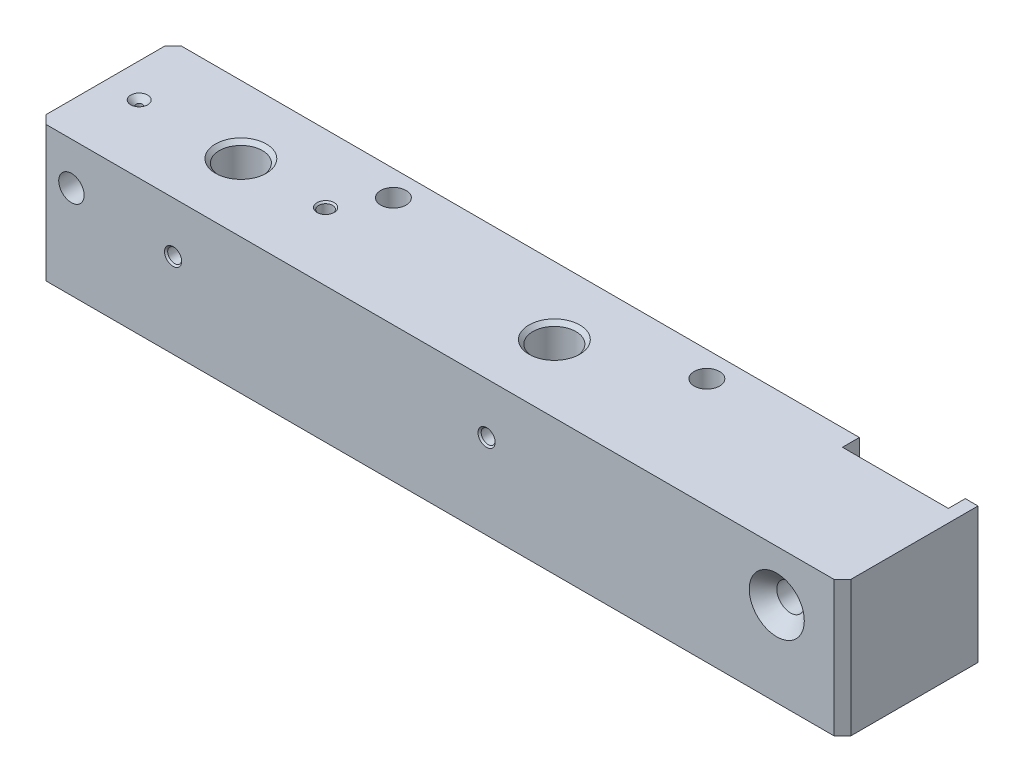
from build123d import *

# Parameters (mm, degrees)
SKETCH1_W                                            = 190
SKETCH1_H                                            = 32
BOSS_EXTRUDE1_DEPTH                                  = 16
CHAMFER1_SIZE                                        = 2
SKETCH2_W                                            = 25
SKETCH2_H                                            = 4
CUT_EXTRUDE1_DEPTH                                   = 102.513545894
M12_TAPPED_HOLE1_D                                   = 10.2
M12_TAPPED_HOLE1_DEPTH                               = 24
M12_TAPPED_HOLE1_CSINK_D                             = 12.005
M12_TAPPED_HOLE1_CSINK_ANGLE                         = 90
M12_TAPPED_HOLE1_TIP                                 = 3.064389157
M4_TAPPED_HOLE2_D                                    = 3.3
M4_TAPPED_HOLE2_DEPTH                                = 11.5
M4_TAPPED_HOLE2_CSINK_D                              = 4.05
M4_TAPPED_HOLE2_CSINK_ANGLE                          = 90
M4_TAPPED_HOLE2_TIP                                  = 0.991420021
CSK_FOR_M10_COUNTERSUNK_FLAT_HEAD_SCREW1_D           = 6.5
CSK_FOR_M10_COUNTERSUNK_FLAT_HEAD_SCREW1_CSINK_D     = 13
CSK_FOR_M10_COUNTERSUNK_FLAT_HEAD_SCREW1_CSINK_ANGLE = 90
SKETCH16_R                                           = 3
CUT_EXTRUDE2_DEPTH                                   = 102.513545894
CSK_FOR_M4_COUNTERSUNK_FLAT_HEAD_SCREW1_D            = 1.5
CSK_FOR_M4_COUNTERSUNK_FLAT_HEAD_SCREW1_DEPTH        = 10
CSK_FOR_M4_COUNTERSUNK_FLAT_HEAD_SCREW1_CSINK_D      = 4
CSK_FOR_M4_COUNTERSUNK_FLAT_HEAD_SCREW1_CSINK_ANGLE  = 90
CSK_FOR_M4_COUNTERSUNK_FLAT_HEAD_SCREW1_TIP          = 0.450645464
M4_TAPPED_HOLE3_D                                    = 3.3
M4_TAPPED_HOLE3_DEPTH                                = 16
M4_TAPPED_HOLE3_CSINK_D                              = 4.05
M4_TAPPED_HOLE3_CSINK_ANGLE                          = 90
M4_TAPPED_HOLE3_TIP                                  = 0.991420021
SKETCH24_R                                           = 3
CUT_EXTRUDE4_DEPTH                                   = 102.51354591


with BuildPart() as part:
    # Sketch1 → Boss-Extrude1 (new, symmetric)
    with BuildSketch(Plane.XY):
        Rectangle(SKETCH1_W, SKETCH1_H)
    extrude(amount=BOSS_EXTRUDE1_DEPTH, both=True)

    # Chamfer1
    chamfer1_edges = [part.edges().sort_by_distance(p)[0] for p in [
        (-95, 0, -16),
        (95, 0, 16),
        (-95, 0, 16),
    ]]
    chamfer(chamfer1_edges, length=CHAMFER1_SIZE)

    # Sketch2 → Cut-Extrude1 (cut, through all)
    with BuildSketch(Plane(origin=(0, 16, 0), x_dir=(1, 0, 0), z_dir=(0, 1, 0))):
        with Locations((79.5, 14)):
            Rectangle(SKETCH2_W, SKETCH2_H)
    extrude(amount=-CUT_EXTRUDE1_DEPTH, mode=Mode.SUBTRACT)

    # M12 Tapped Hole1
    with Locations(Plane(origin=(0, 16, 0), x_dir=(1, 0, 0), z_dir=(0, 1, 0))):
        with Locations((-63, 0), (11, 0)):
            CounterSinkHole(M12_TAPPED_HOLE1_D / 2, M12_TAPPED_HOLE1_CSINK_D / 2, depth=M12_TAPPED_HOLE1_DEPTH, counter_sink_angle=M12_TAPPED_HOLE1_CSINK_ANGLE)
            with Locations((0, 0, -(M12_TAPPED_HOLE1_DEPTH + M12_TAPPED_HOLE1_TIP / 2))):  # 118° drill point
                Cone(0, M12_TAPPED_HOLE1_D / 2, M12_TAPPED_HOLE1_TIP, mode=Mode.SUBTRACT)

    # M4 Tapped Hole2
    with Locations(Plane(origin=(-63, 4, 16), x_dir=(1, 0, 0), z_dir=(0, 0, 1))):
        with Locations((0, 0), (74, 0)):
            CounterSinkHole(M4_TAPPED_HOLE2_D / 2, M4_TAPPED_HOLE2_CSINK_D / 2, depth=M4_TAPPED_HOLE2_DEPTH, counter_sink_angle=M4_TAPPED_HOLE2_CSINK_ANGLE)
            with Locations((0, 0, -(M4_TAPPED_HOLE2_DEPTH + M4_TAPPED_HOLE2_TIP / 2))):  # 118° drill point
                Cone(0, M4_TAPPED_HOLE2_D / 2, M4_TAPPED_HOLE2_TIP, mode=Mode.SUBTRACT)

    # CSK for M10 Countersunk Flat Head Screw1 (through all)
    with Locations(Plane.XY.offset(16)):
        with Locations((79.5, 4)):
            CounterSinkHole(CSK_FOR_M10_COUNTERSUNK_FLAT_HEAD_SCREW1_D / 2, CSK_FOR_M10_COUNTERSUNK_FLAT_HEAD_SCREW1_CSINK_D / 2, counter_sink_angle=CSK_FOR_M10_COUNTERSUNK_FLAT_HEAD_SCREW1_CSINK_ANGLE)

    # Sketch16 → Cut-Extrude2 (cut, through all)
    with BuildSketch(Plane.XY.offset(16)):
        with Locations((-87, 6)):
            Circle(SKETCH16_R)
    extrude(amount=-CUT_EXTRUDE2_DEPTH, mode=Mode.SUBTRACT)

    # CSK for M4 Countersunk Flat Head Screw1
    with Locations(Plane(origin=(0, 16, 0), x_dir=(1, 0, 0), z_dir=(0, 1, 0))):
        with Locations((-87, 0)):
            CounterSinkHole(CSK_FOR_M4_COUNTERSUNK_FLAT_HEAD_SCREW1_D / 2, CSK_FOR_M4_COUNTERSUNK_FLAT_HEAD_SCREW1_CSINK_D / 2, depth=CSK_FOR_M4_COUNTERSUNK_FLAT_HEAD_SCREW1_DEPTH, counter_sink_angle=CSK_FOR_M4_COUNTERSUNK_FLAT_HEAD_SCREW1_CSINK_ANGLE)
            with Locations((0, 0, -(CSK_FOR_M4_COUNTERSUNK_FLAT_HEAD_SCREW1_DEPTH + CSK_FOR_M4_COUNTERSUNK_FLAT_HEAD_SCREW1_TIP / 2))):  # 118° drill point
                Cone(0, CSK_FOR_M4_COUNTERSUNK_FLAT_HEAD_SCREW1_D / 2, CSK_FOR_M4_COUNTERSUNK_FLAT_HEAD_SCREW1_TIP, mode=Mode.SUBTRACT)

    # M4 Tapped Hole3
    with Locations(Plane(origin=(0, 16, 0), x_dir=(1, 0, 0), z_dir=(0, 1, 0))):
        with Locations((-43, 0)):
            CounterSinkHole(M4_TAPPED_HOLE3_D / 2, M4_TAPPED_HOLE3_CSINK_D / 2, depth=M4_TAPPED_HOLE3_DEPTH, counter_sink_angle=M4_TAPPED_HOLE3_CSINK_ANGLE)
            with Locations((0, 0, -(M4_TAPPED_HOLE3_DEPTH + M4_TAPPED_HOLE3_TIP / 2))):  # 118° drill point
                Cone(0, M4_TAPPED_HOLE3_D / 2, M4_TAPPED_HOLE3_TIP, mode=Mode.SUBTRACT)

    # Sketch24 → Cut-Extrude4 (cut, through all)
    with BuildSketch(Plane(origin=(0, 16, 0), x_dir=(1, 0, 0), z_dir=(0, 1, 0))):
        with Locations((-37, 10)):
            Circle(SKETCH24_R)
        with Locations((37, 10)):
            Circle(SKETCH24_R)
    extrude(amount=-CUT_EXTRUDE4_DEPTH, mode=Mode.SUBTRACT)


solid = part.part
